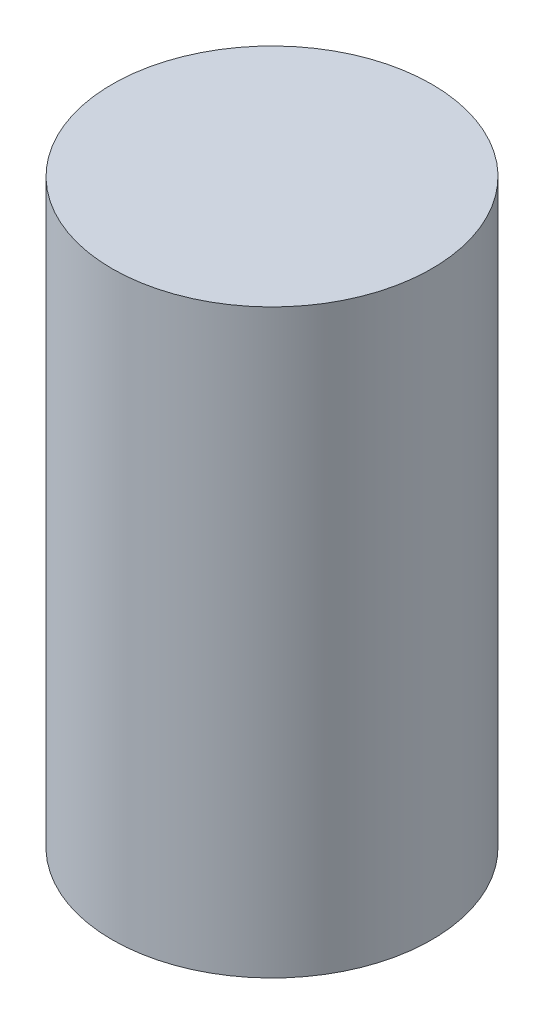
from build123d import *

# Parameters (mm, degrees)
SKETCH_1_R      = 33
EXTRUDE_1_DEPTH = 120


with BuildPart() as part:
    # Эскиз1 → Бобышка-Вытянуть1 (new body)
    with BuildSketch(Plane(origin=(0, 0, 0), x_dir=(1, 0, 0), z_dir=(0, 1, 0))):
        Circle(SKETCH_1_R)
    extrude(amount=EXTRUDE_1_DEPTH)


solid = part.part
